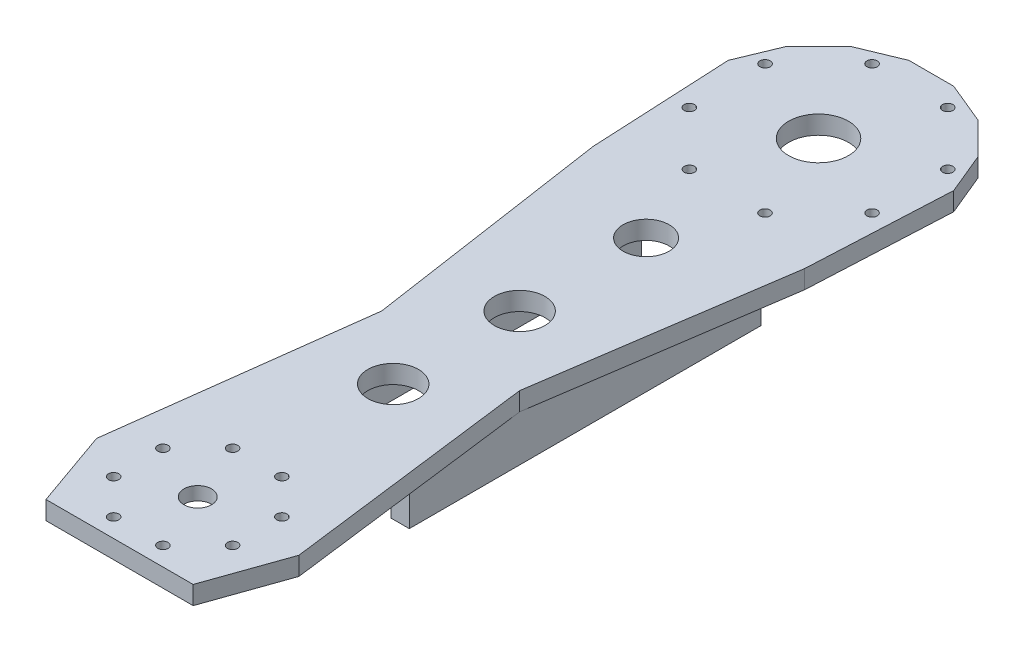
from build123d import *

# Parameters (mm, degrees)
SK_THIGH_PLATE_R         = 2.25
SK_THIGH_PLATE_R_2       = 6
SK_THIGH_PLATE_R_3       = 13
SK_THIGH_PLATE_R_4       = 11
SK_THIGH_PLATE_R_5       = 10
THIGH_PLATE_DEPTH        = 8
SK_PITCH_PILOT_RECESS_R  = 22.15
PITCH_PILOT_RECESS_DEPTH = 2.2
SK_FRONT_FLANGE_W        = 153
SK_FRONT_FLANGE_H        = 20
FRONT_FLANGE_DEPTH       = 8
SK_BACK_FLANGE_W         = 153
SK_BACK_FLANGE_H         = 20
BACK_FLANGE_DEPTH        = 8


with BuildPart() as part:
    # SK_Thigh_Plate → Thigh_Plate (new body)
    with BuildSketch(Plane(origin=(0, 36, 0), x_dir=(1, 0, 0), z_dir=(0, 1, 0))):
        Polygon((-32, -34), (32, -34), (44, 0), (30, 110), (46, 218), (49.03926402, 279.754516101), (41.573480615, 297.778511651), (27.778511651, 311.573480615), (9.754516101, 319.03926402), (-9.754516101, 319.03926402), (-27.778511651, 311.573480615), (-41.573480615, 297.778511651), (-49.03926402, 279.754516101), (-46, 218), (-30, 110), (-44, 0), align=None)
        with Locations((25.86862691, 10.715136106)):
            Circle(SK_THIGH_PLATE_R, mode=Mode.SUBTRACT)
        with Locations((10.715136106, 25.86862691)):
            Circle(SK_THIGH_PLATE_R, mode=Mode.SUBTRACT)
        with Locations((-10.715136106, 25.86862691)):
            Circle(SK_THIGH_PLATE_R, mode=Mode.SUBTRACT)
        with Locations((-25.86862691, 10.715136106)):
            Circle(SK_THIGH_PLATE_R, mode=Mode.SUBTRACT)
        with Locations((-25.86862691, -10.715136106)):
            Circle(SK_THIGH_PLATE_R, mode=Mode.SUBTRACT)
        with Locations((-10.715136106, -25.86862691)):
            Circle(SK_THIGH_PLATE_R, mode=Mode.SUBTRACT)
        with Locations((10.715136106, -25.86862691)):
            Circle(SK_THIGH_PLATE_R, mode=Mode.SUBTRACT)
        with Locations((25.86862691, -10.715136106)):
            Circle(SK_THIGH_PLATE_R, mode=Mode.SUBTRACT)
        with Locations((39.726819898, 286.455387592)):
            Circle(SK_THIGH_PLATE_R, mode=Mode.SUBTRACT)
        with Locations((16.455387592, 309.726819898)):
            Circle(SK_THIGH_PLATE_R, mode=Mode.SUBTRACT)
        with Locations((-16.455387592, 309.726819898)):
            Circle(SK_THIGH_PLATE_R, mode=Mode.SUBTRACT)
        with Locations((-39.726819898, 286.455387592)):
            Circle(SK_THIGH_PLATE_R, mode=Mode.SUBTRACT)
        with Locations((-39.726819898, 253.544612408)):
            Circle(SK_THIGH_PLATE_R, mode=Mode.SUBTRACT)
        with Locations((-16.455387592, 230.273180102)):
            Circle(SK_THIGH_PLATE_R, mode=Mode.SUBTRACT)
        with Locations((16.455387592, 230.273180102)):
            Circle(SK_THIGH_PLATE_R, mode=Mode.SUBTRACT)
        with Locations((39.726819898, 253.544612408)):
            Circle(SK_THIGH_PLATE_R, mode=Mode.SUBTRACT)
        Circle(SK_THIGH_PLATE_R_2, mode=Mode.SUBTRACT)
        with Locations((0, 270)):
            Circle(SK_THIGH_PLATE_R_3, mode=Mode.SUBTRACT)
        with Locations((0, 85)):
            Circle(SK_THIGH_PLATE_R_4, mode=Mode.SUBTRACT)
        with Locations((0, 140)):
            Circle(SK_THIGH_PLATE_R_4, mode=Mode.SUBTRACT)
        with Locations((0, 195)):
            Circle(SK_THIGH_PLATE_R_5, mode=Mode.SUBTRACT)
    extrude(amount=THIGH_PLATE_DEPTH)

    # SK_Pitch_Pilot_Recess → Pitch_Pilot_Recess (cut)
    with BuildSketch(Plane(origin=(0, 36, 0), x_dir=(1, 0, 0), z_dir=(0, 1, 0))):
        Circle(SK_PITCH_PILOT_RECESS_R)
    extrude(amount=PITCH_PILOT_RECESS_DEPTH, mode=Mode.SUBTRACT)

    # SK_Front_Flange → Front_Flange (add)
    with BuildSketch(Plane(origin=(22, 0, 0), x_dir=(0, 0, -1), z_dir=(1, 0, 0))):
        with Locations((138.5, 26)):
            Rectangle(SK_FRONT_FLANGE_W, SK_FRONT_FLANGE_H)
    extrude(amount=FRONT_FLANGE_DEPTH)

    # SK_Back_Flange → Back_Flange (add)
    with BuildSketch(Plane(origin=(-30, 0, 0), x_dir=(0, 0, -1), z_dir=(1, 0, 0))):
        with Locations((138.5, 26)):
            Rectangle(SK_BACK_FLANGE_W, SK_BACK_FLANGE_H)
    extrude(amount=BACK_FLANGE_DEPTH)


solid = part.part
